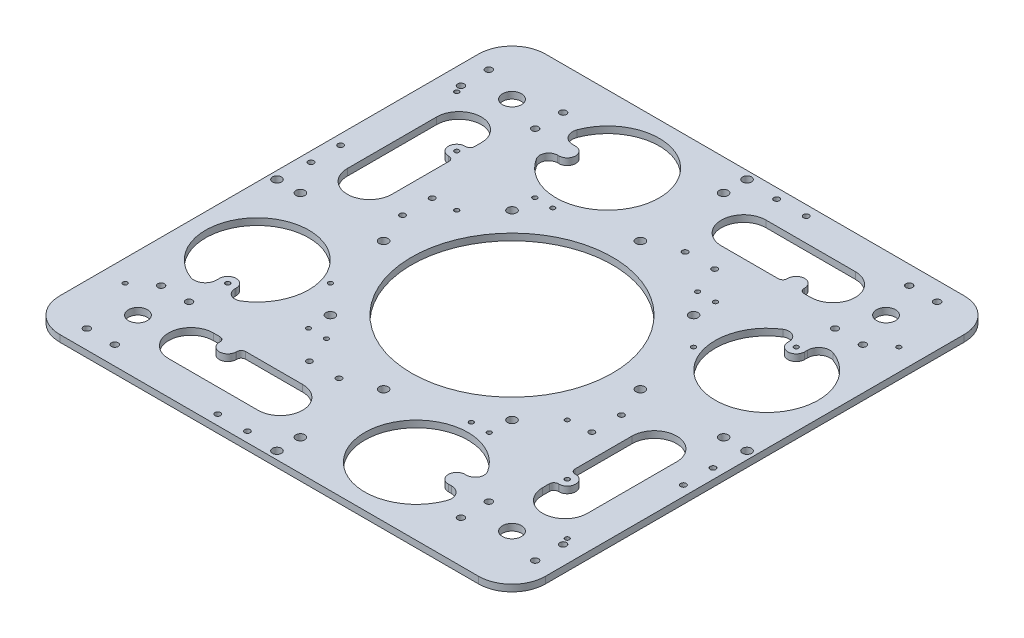
from build123d import *

# Parameters (mm, degrees)
SKETCH1_W           = 435
SKETCH1_H           = 435
SKETCH1_R           = 4
SKETCH1_R_2         = 90
SKETCH1_R_3         = 8.5
BOSS_EXTRUDE1_DEPTH = 6
SKETCH2_R           = 2.5
SKETCH2_R_2         = 3
CUT_EXTRUDE1_DEPTH  = 10
CIRPATTERN1_COUNT   = 4
FILLET1_R           = 30
SKETCH4_R           = 2
CUT_EXTRUDE3_DEPTH  = 10
SKETCH6_R           = 2
CUT_EXTRUDE4_DEPTH  = 10
CUT_EXTRUDE6_DEPTH  = 10
CIRPATTERN3_COUNT   = 4


with BuildPart() as part:
    # Sketch1 → Boss-Extrude1 (new body)
    with BuildSketch(Plane(origin=(0, 0, 0), x_dir=(1, 0, 0), z_dir=(0, 1, 0))):
        Rectangle(SKETCH1_W, SKETCH1_H)
        with Locations((0, 115)):
            Circle(SKETCH1_R, mode=Mode.SUBTRACT)
        Circle(SKETCH1_R_2, mode=Mode.SUBTRACT)
        with Locations((-189.5, 0)):
            Circle(SKETCH1_R, mode=Mode.SUBTRACT)
        with Locations((-210.5, 0)):
            Circle(SKETCH1_R, mode=Mode.SUBTRACT)
        with Locations((0, -210.5)):
            Circle(SKETCH1_R, mode=Mode.SUBTRACT)
        with Locations((0, -189.5)):
            Circle(SKETCH1_R, mode=Mode.SUBTRACT)
        with Locations((81.317279836, 81.317279836)):
            Circle(SKETCH1_R, mode=Mode.SUBTRACT)
        with Locations((115, 0)):
            Circle(SKETCH1_R, mode=Mode.SUBTRACT)
        with Locations((81.317279836, -81.317279836)):
            Circle(SKETCH1_R, mode=Mode.SUBTRACT)
        with Locations((0, -115)):
            Circle(SKETCH1_R, mode=Mode.SUBTRACT)
        with Locations((-81.317279836, -81.317279836)):
            Circle(SKETCH1_R, mode=Mode.SUBTRACT)
        with Locations((-115, 0)):
            Circle(SKETCH1_R, mode=Mode.SUBTRACT)
        with Locations((-81.317279836, 81.317279836)):
            Circle(SKETCH1_R, mode=Mode.SUBTRACT)
        with Locations((0, 189.5)):
            Circle(SKETCH1_R, mode=Mode.SUBTRACT)
        with Locations((0, 210.5)):
            Circle(SKETCH1_R, mode=Mode.SUBTRACT)
        with Locations((189.5, 0)):
            Circle(SKETCH1_R, mode=Mode.SUBTRACT)
        with Locations((210.5, 0)):
            Circle(SKETCH1_R, mode=Mode.SUBTRACT)
        with Locations((167.5, 167.5)):
            Circle(SKETCH1_R_3, mode=Mode.SUBTRACT)
        with Locations((167.5, -167.5)):
            Circle(SKETCH1_R_3, mode=Mode.SUBTRACT)
        with Locations((-167.5, -167.5)):
            Circle(SKETCH1_R_3, mode=Mode.SUBTRACT)
        with Locations((-167.5, 167.5)):
            Circle(SKETCH1_R_3, mode=Mode.SUBTRACT)
    extrude(amount=BOSS_EXTRUDE1_DEPTH)

    # Sketch2 → Cut-Extrude1 (cut)
    with BuildSketch(Plane(origin=(0, 6, 0), x_dir=(1, 0, 0), z_dir=(0, 1, 0))):
        with Locations((-28.5, -126.5)):
            Circle(SKETCH2_R)
        with Locations((-55, -126.5)):
            Circle(SKETCH2_R)
        with Locations((-55, -208.5)):
            Circle(SKETCH2_R)
        with Locations((-28.5, -208.5)):
            Circle(SKETCH2_R)
        with Locations((-180, -134.2567)):
            Circle(SKETCH2_R_2)
        with Locations((-155, -134.2567)):
            Circle(SKETCH2_R_2)
        with Locations((-155, -200.7433)):
            Circle(SKETCH2_R_2)
        with Locations((-180, -200.7433)):
            Circle(SKETCH2_R_2)
    cut_extrude1 = extrude(amount=-CUT_EXTRUDE1_DEPTH, mode=Mode.SUBTRACT)

    # CirPattern1: Cut-Extrude1 ×4 about axis
    cirpattern1_axis = Axis((0, 6, 0), (0, -1, 0))
    for i in range(1, CIRPATTERN1_COUNT):
        add(cut_extrude1.rotate(cirpattern1_axis, i * 360 / CIRPATTERN1_COUNT), mode=Mode.SUBTRACT)

    # Fillet1
    fillet1_edges = [part.edges().sort_by_distance(p)[0] for p in [
        (217.5, 3, 217.5),
        (217.5, 3, -217.5),
        (-217.5, 3, 217.5),
        (-217.5, 3, -217.5),
    ]]
    fillet(fillet1_edges, radius=FILLET1_R)

    # Sketch4 → Cut-Extrude3 (cut)
    with BuildSketch(Plane(origin=(0, 6, 0), x_dir=(1, 0, 0), z_dir=(0, 1, 0))):
        with Locations((80.9, 101.317279836)):
            Circle(SKETCH4_R)
        with Locations((64.9, 101.317279836)):
            Circle(SKETCH4_R)
        with Locations((-80.9, 101.317279836)):
            Circle(SKETCH4_R)
        with Locations((-64.9, 101.317279836)):
            Circle(SKETCH4_R)
        with Locations((-64.9, -101.317279836)):
            Circle(SKETCH4_R)
        with Locations((-80.9, -101.317279836)):
            Circle(SKETCH4_R)
        with Locations((64.9, -101.317279836)):
            Circle(SKETCH4_R)
        with Locations((80.9, -101.317279836)):
            Circle(SKETCH4_R)
    extrude(amount=-CUT_EXTRUDE3_DEPTH, mode=Mode.SUBTRACT)

    # Sketch6 → Cut-Extrude4 (cut)
    with BuildSketch(Plane(origin=(0, 6, 0), x_dir=(1, 0, 0), z_dir=(0, 1, 0))):
        with Locations((-152.027957955, -102.530483272)):
            Circle(SKETCH6_R)
        with Locations((-197.989898732, -148.492424049)):
            Circle(SKETCH6_R)
        with Locations((-106.066017178, -56.568542495)):
            Circle(SKETCH6_R)
        with Locations((-197.989898732, 148.492424049)):
            Circle(SKETCH6_R)
        with Locations((-152.027957955, 102.530483272)):
            Circle(SKETCH6_R)
        with Locations((-106.066017178, 56.568542495)):
            Circle(SKETCH6_R)
        with Locations((106.066017178, 56.568542495)):
            Circle(SKETCH6_R)
        with Locations((152.027957955, 102.530483272)):
            Circle(SKETCH6_R)
        with Locations((197.989898732, 148.492424049)):
            Circle(SKETCH6_R)
        with Locations((197.989898732, -148.492424049)):
            Circle(SKETCH6_R)
        with Locations((152.027957955, -102.530483272)):
            Circle(SKETCH6_R)
        with Locations((106.066017178, -56.568542495)):
            Circle(SKETCH6_R)
    extrude(amount=-CUT_EXTRUDE4_DEPTH, mode=Mode.SUBTRACT)

    # Sketch3 → Cut-Extrude6 (cut)
    with BuildSketch(Plane(origin=(0, 6, 0), x_dir=(1, 0, 0), z_dir=(0, 1, 0))):
        with BuildLine():
            Line((-114.030483272, -147.5), (-120, -147.5))
            ThreePointArc((-120, -147.5), (-140, -167.5), (-120, -187.5))
            Line((-120, -187.5), (-40, -187.5))
            ThreePointArc((-40, -187.5), (-20, -167.5), (-40, -147.5))
            Line((-40, -147.5), (-91.030483272, -147.5))
            ThreePointArc((-91.030483272, -147.5), (-93.858910397, -148.671572875), (-95.030483272, -151.5))
            Line((-95.030483272, -151.5), (-95.030483272, -152.027957955))
            ThreePointArc((-95.030483272, -152.027957955), (-102.530483272, -159.527957955), (-110.030483272, -152.027957955))
            Line((-110.030483272, -152.027957955), (-110.030483272, -151.5))
            ThreePointArc((-110.030483272, -151.5), (-111.202056147, -148.671572875), (-114.030483272, -147.5))
        make_face()
        with BuildLine():
            Line((105.225166756, -159.527957955), (102.530483272, -159.527957955))
            ThreePointArc((102.530483272, -159.527957955), (95.030483272, -152.027957955), (102.530483272, -144.527957955))
            Line((102.530483272, -144.527957955), (103.621215852, -144.527957955))
            ThreePointArc((103.621215852, -144.527957955), (110.624232404, -140.395484189), (110.392303411, -132.267397748))
            ThreePointArc((110.392303411, -132.267397748), (25.2444819, -161.646987624), (114.598508371, -173.012275242))
            ThreePointArc((114.598508371, -173.012275242), (113.436231634, -163.820207648), (105.225166756, -159.527957955))
        make_face()
    cut_extrude6 = extrude(amount=-CUT_EXTRUDE6_DEPTH, mode=Mode.SUBTRACT)

    # CirPattern3: Cut-Extrude6 ×4 about axis
    cirpattern3_axis = Axis((0, 6, 0), (0, -1, 0))
    for i in range(1, CIRPATTERN3_COUNT):
        add(cut_extrude6.rotate(cirpattern3_axis, i * 360 / CIRPATTERN3_COUNT), mode=Mode.SUBTRACT)


solid = part.part
